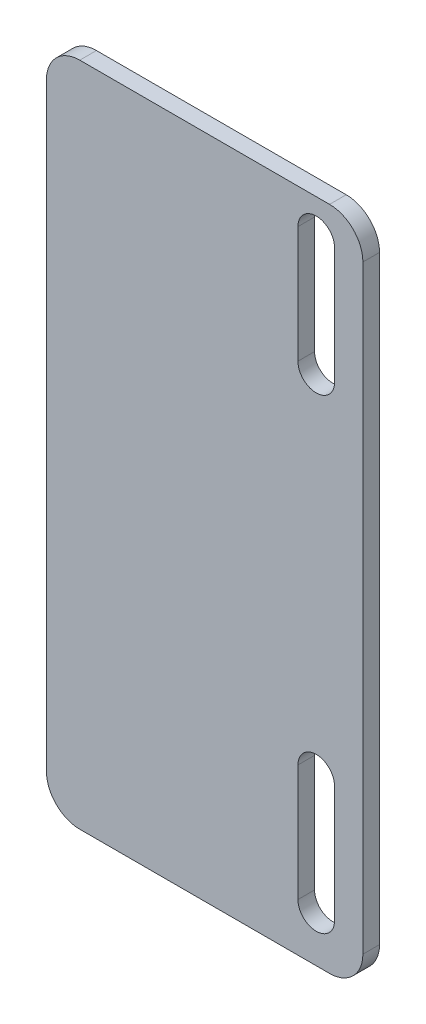
from build123d import *

# Parameters (mm, degrees)
SKETCH_1_W          = 19
SKETCH_1_H          = 40
EXTRUDE_1_DEPTH     = 1
FILLET_1_R          = 2
CUT_EXTRUDE_1_DEPTH = 45.294469181


with BuildPart() as part:
    # Эскиз1 → Бобышка-Вытянуть1 (new body)
    with BuildSketch(Plane.XY):
        with Locations((9.5, 20)):
            Rectangle(SKETCH_1_W, SKETCH_1_H)
    extrude(amount=EXTRUDE_1_DEPTH)

    # Скругление1
    fillet_1_edges = [part.edges().sort_by_distance(p)[0] for p in [
        (19, 0, 0.5),
        (0, 0, 0.5),
        (0, 40, 0.5),
        (19, 40, 0.5),
    ]]
    fillet(fillet_1_edges, radius=FILLET_1_R)

    # Эскиз3 → Вырез-Вытянуть1 (cut, through all)
    with BuildSketch(Plane.XY.offset(1)):
        with BuildLine():
            Line((15.1, 2.893381891), (15.1, 9.893381891))
            ThreePointArc((15.1, 9.893381891), (16.2, 10.993381891), (17.3, 9.893381891))
            Line((17.3, 9.893381891), (17.3, 2.893381891))
            ThreePointArc((17.3, 2.893381891), (16.2, 1.793381891), (15.1, 2.893381891))
        make_face()
        with BuildLine():
            Line((15.1, 30.893381891), (15.1, 37.893381891))
            ThreePointArc((15.1, 37.893381891), (16.2, 38.993381891), (17.3, 37.893381891))
            Line((17.3, 37.893381891), (17.3, 30.893381891))
            ThreePointArc((17.3, 30.893381891), (16.2, 29.793381891), (15.1, 30.893381891))
        make_face()
    extrude(amount=-CUT_EXTRUDE_1_DEPTH, mode=Mode.SUBTRACT)


solid = part.part
